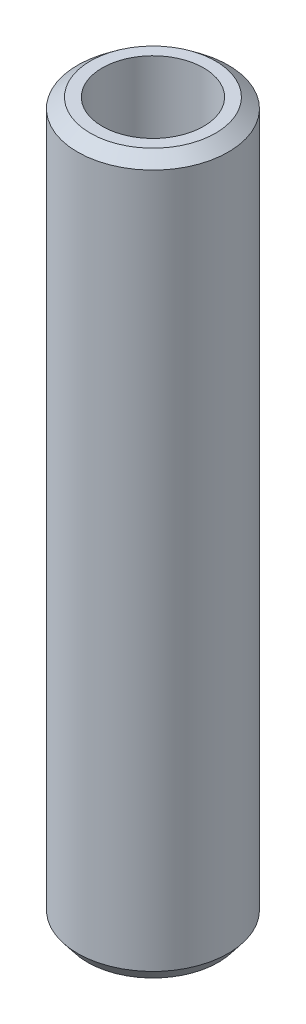
from build123d import *
from OCP.BRepFilletAPI import BRepFilletAPI_MakeChamfer

# Parameters (mm, degrees)
SKETCH1_R           = 40
BOSS_EXTRUDE1_DEPTH = 380.48945965
SKETCH2_R           = 26.906484987
CUT_EXTRUDE1_DEPTH  = 385.671585777
CHAMFER1_SIZE       = 5.29216888
CHAMFER1_SIZE2      = 6.771157045


with BuildPart() as part:
    # Sketch1 → Boss-Extrude1 (new body)
    with BuildSketch(Plane(origin=(0, 0, 0), x_dir=(1, 0, 0), z_dir=(0, 1, 0))):
        Circle(SKETCH1_R)
    extrude(amount=BOSS_EXTRUDE1_DEPTH)

    # Sketch2 → Cut-Extrude1 (cut, through all)
    with BuildSketch(Plane(origin=(0, 0, 0), x_dir=(1, 0, 0), z_dir=(0, 1, 0))):
        Circle(SKETCH2_R)
    extrude(amount=CUT_EXTRUDE1_DEPTH, mode=Mode.SUBTRACT)

    # Chamfer1: one chamfer whose edges measure the first distance from different faces: ONE call of the kernel's chamfer builder (chamfer() names one face for all edges)
    chamfer1_edges_1 = [part.edges().sort_by_distance(p)[0] for p in [
        (-40, 380.48945965, 0),
    ]]
    chamfer1_side_1 = [part.faces().sort_by_distance(p)[0] for p in [
        (-40, 190.244729825, 0),
    ]]
    chamfer1_edges_2 = [part.edges().sort_by_distance(p)[0] for p in [
        (-40, 0, 0),
    ]]
    chamfer1_side_2 = [part.faces().sort_by_distance(p)[0] for p in [
        (-38.86862915, 0, 0),
    ]]
    chamfer1 = BRepFilletAPI_MakeChamfer(part.part.solid().wrapped)
    for e in chamfer1_edges_1:
        chamfer1.Add(CHAMFER1_SIZE, CHAMFER1_SIZE2, e.wrapped, chamfer1_side_1[0].wrapped)  # the first distance lies on this face
    for e in chamfer1_edges_2:
        chamfer1.Add(CHAMFER1_SIZE, CHAMFER1_SIZE2, e.wrapped, chamfer1_side_2[0].wrapped)  # the first distance lies on this face
    add(Compound.cast(chamfer1.Shape()), mode=Mode.REPLACE)


solid = part.part
